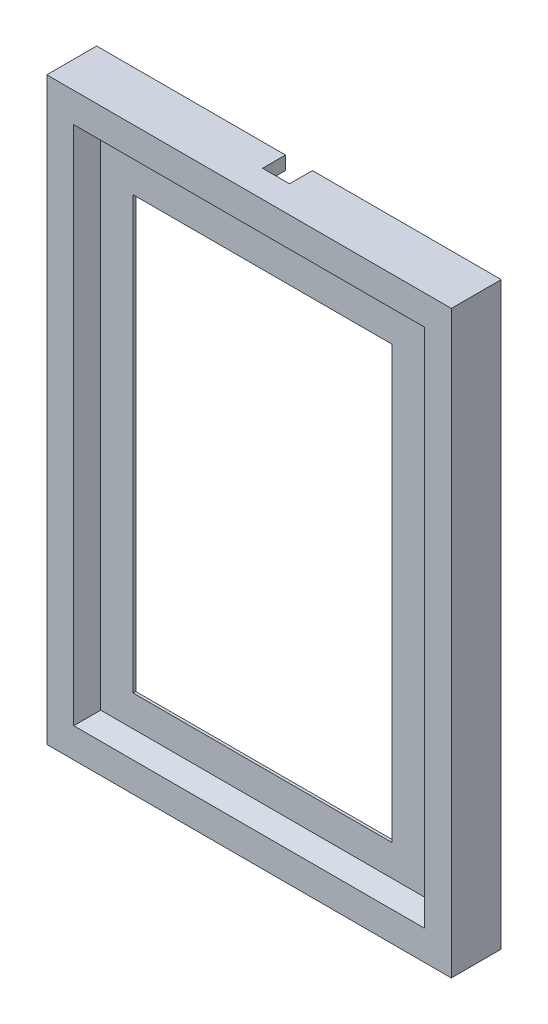
from build123d import *

# Parameters (mm, degrees)
SKETCH_1_W          = 150
SKETCH_1_H          = 215
SKETCH_1_W_2        = 96
SKETCH_1_H_2        = 160
EXTRUDE_1_DEPTH     = 15
SKETCH_2_W          = 120
SKETCH_2_H          = 183
CUT_EXTRUDE_1_DEPTH = 5
CHAMFER_1_SIZE      = 5
SKETCH_5_W          = 130
SKETCH_5_H          = 190
CUT_EXTRUDE_2_DEPTH = 9
SKETCH_9_W          = 130
SKETCH_9_H          = 205
CUT_EXTRUDE_6_DEPTH = 4
SKETCH_10_R         = 2.5
CUT_EXTRUDE_7_DEPTH = 6
SKETCH_11_W         = 10
SKETCH_11_H         = 215
CUT_EXTRUDE_8_DEPTH = 5
EXTRUDE_2_DEPTH     = 3.5


with BuildPart() as part:
    # 草图1 → 凸台-拉伸1 (new body)
    with BuildSketch(Plane.XY):
        Rectangle(SKETCH_1_W, SKETCH_1_H)
        Rectangle(SKETCH_1_W_2, SKETCH_1_H_2, mode=Mode.SUBTRACT)
    extrude(amount=EXTRUDE_1_DEPTH)

    # 草图2 → 切除-拉伸1 (cut)
    with BuildSketch(Plane.XY.offset(15)):
        Rectangle(SKETCH_2_W, SKETCH_2_H)
    extrude(amount=-CUT_EXTRUDE_1_DEPTH, mode=Mode.SUBTRACT)

    # 倒角1
    chamfer_1_edges = [part.edges().sort_by_distance(p)[0] for p in [
        (0, -91.5, 15),
        (60, 0, 15),
        (-60, 0, 15),
        (0, 91.5, 15),
    ]]
    chamfer(chamfer_1_edges, length=CHAMFER_1_SIZE - 0.0001)  # a hair under: the kernel refuses the full size

    # 草图5 → 切除-拉伸2 (cut)
    with BuildSketch(Plane(origin=(0, 0, 0), x_dir=(-1, 0, 0), z_dir=(0, 0, -1))):
        Rectangle(SKETCH_5_W, SKETCH_5_H)
    extrude(amount=-CUT_EXTRUDE_2_DEPTH, mode=Mode.SUBTRACT)

    # 草图9 → 切除-拉伸6 (cut)
    with BuildSketch(Plane(origin=(0, 0, 0), x_dir=(-1, 0, 0), z_dir=(0, 0, -1))):
        Rectangle(SKETCH_9_W, SKETCH_9_H)
    extrude(amount=-CUT_EXTRUDE_6_DEPTH, mode=Mode.SUBTRACT)

    # 草图10 → 切除-拉伸7 (cut)
    with BuildSketch(Plane(origin=(0, 0, 4), x_dir=(-1, 0, 0), z_dir=(0, 0, -1))):
        with Locations((61, 98.5)):
            Circle(SKETCH_10_R)
        with Locations((-61, 98.5)):
            Circle(SKETCH_10_R)
        with Locations((-61, -98.5)):
            Circle(SKETCH_10_R)
        with Locations((61, -98.5)):
            Circle(SKETCH_10_R)
    extrude(amount=-CUT_EXTRUDE_7_DEPTH, mode=Mode.SUBTRACT)

    # 草图11 → 切除-拉伸8 (cut)
    with BuildSketch(Plane(origin=(0, 0, 0), x_dir=(-1, 0, 0), z_dir=(0, 0, -1))):
        Rectangle(SKETCH_11_W, SKETCH_11_H)
    extrude(amount=-CUT_EXTRUDE_8_DEPTH, mode=Mode.SUBTRACT)

    # 草图12 → 凸台-拉伸2 (add)
    with BuildSketch(Plane(origin=(0, 0, 0), x_dir=(-1, 0, 0), z_dir=(0, 0, -1))):
        Polygon((-5, 107.5), (-75, 107.5), (-75, -107.5), (-5, -107.5), (-5, -102.5), (-65, -102.5), (-65, 102.5), (-5, 102.5), align=None)
        Polygon((5, -102.5), (5, -107.5), (75, -107.5), (75, 107.5), (5, 107.5), (5, 102.5), (65, 102.5), (65, -102.5), align=None)
    extrude(amount=EXTRUDE_2_DEPTH)


solid = part.part
